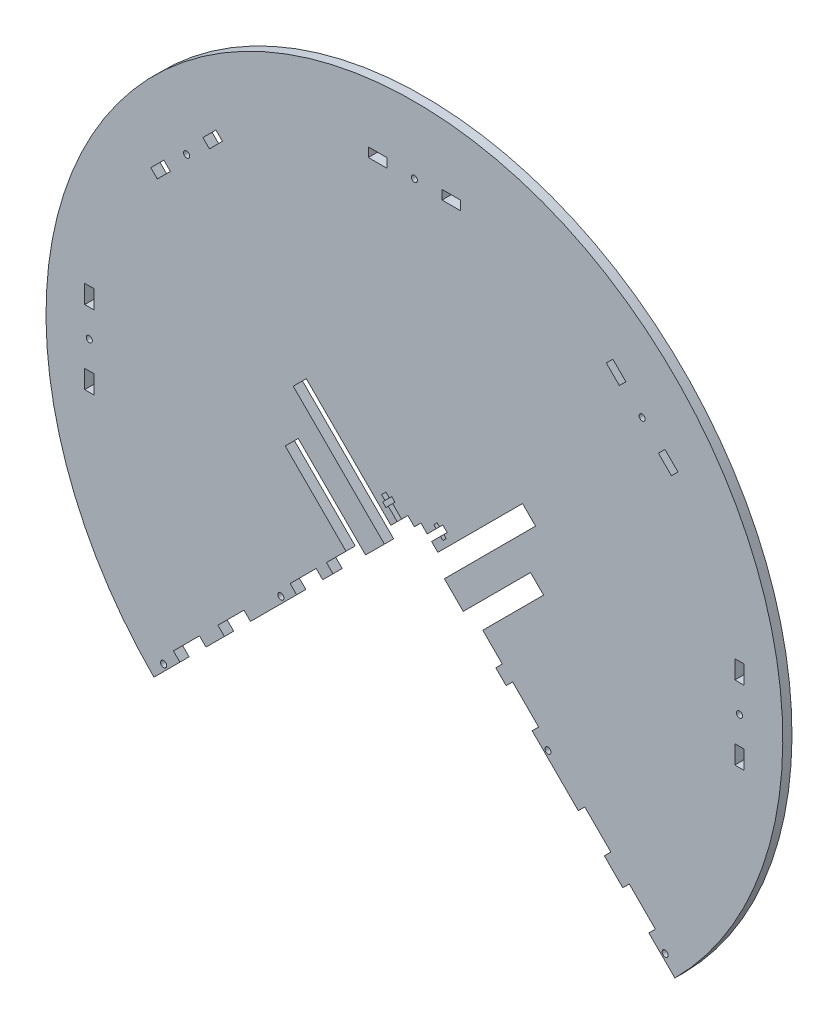
from build123d import *

# Parameters (mm, degrees)
SKETCH1_R           = 254
BOSS_EXTRUDE1_DEPTH = 6.35
CUT_EXTRUDE1_DEPTH  = 530.881249762
CUT_EXTRUDE2_DEPTH  = 466.964215177
SKETCH5_W           = 12.7
SKETCH5_H           = 6.35
SKETCH5_W_2         = 6.35
SKETCH5_H_2         = 12.7
CUT_EXTRUDE3_DEPTH  = 466.964215177
SKETCH6_R           = 2.0955
CUT_EXTRUDE4_DEPTH  = 466.964215177
SKETCH7_R           = 2.0955
CUT_EXTRUDE5_DEPTH  = 466.964215177
CUT_EXTRUDE6_DEPTH  = 466.964215177
CUT_EXTRUDE7_DEPTH  = 466.964215177
CUT_EXTRUDE8_DEPTH  = 466.964215177


with BuildPart() as part:
    # Sketch1 → Boss-Extrude1 (new body)
    with BuildSketch(Plane.XY):
        with Locations((0, -210.99227558)):
            Circle(SKETCH1_R)
    extrude(amount=BOSS_EXTRUDE1_DEPTH)

    # Sketch3 → Cut-Extrude1 (cut, through all)
    with BuildSketch(Plane(origin=(0, 0, 0), x_dir=(-1, 0, 0), z_dir=(0, 0, -1))):
        with BuildLine():
            Line((179.605122421, -390.597398001), (0, -210.99227558))
            Line((0, -210.99227558), (-179.605122421, -390.597398001))
            ThreePointArc((-179.605122421, -390.597398001), (0, -464.99227558), (179.605122421, -390.597398001))
        make_face()
    extrude(amount=-CUT_EXTRUDE1_DEPTH, mode=Mode.SUBTRACT)

    # Sketch4 → Cut-Extrude2 (cut, through all)
    with BuildSketch(Plane.XY.offset(6.35)):
        Polygon((-161.644610179, -372.636885759), (-166.13473824, -368.146757699), (-148.174225998, -350.186245456), (-143.684097937, -354.676373517), align=None)
        Polygon((-130.96805527, -341.960330849), (-135.45818333, -337.470202789), (-117.497671088, -319.509690547), (-113.007543028, -323.999818607), align=None)
        Polygon((-81.190495591, -292.18277117), (-85.680623651, -287.69264311), (-67.720111409, -269.732130868), (-63.229983348, -274.222258928), align=None)
        Polygon((-56.126600757, -267.118876336), (-60.616728817, -262.628748276), (-38.166088515, -240.178107973), (-33.675960454, -244.668236034), align=None)
        Polygon((-11.689323621, -222.681599201), (-16.179451682, -218.19147114), (-4.490128061, -206.502147519), (0, -210.99227558), align=None)
    cut_extrude2 = extrude(amount=-CUT_EXTRUDE2_DEPTH, mode=Mode.SUBTRACT)

    # Mirror1: Cut-Extrude2 across plane
    add(cut_extrude2.mirror(Plane(origin=(0, 0, 0), x_dir=(0, 0, 1), z_dir=(1, 0, 0))), mode=Mode.SUBTRACT)

    # Sketch5 → Cut-Extrude3 (cut, through all)
    with BuildSketch(Plane.XY.offset(6.35)):
        Polygon((177.244959777, -91.888783362), (181.735087838, -87.398655301), (172.754831717, -78.41839918), (168.264703656, -82.908527241), align=None)
        with Locations((-25.4, -3.175)):
            Rectangle(SKETCH5_W, SKETCH5_H)
        with Locations((25.4, -3.175)):
            Rectangle(SKETCH5_W, SKETCH5_H)
        with Locations((-224.155, -236.39227558)):
            Rectangle(SKETCH5_W_2, SKETCH5_H_2)
        with Locations((-224.155, -185.59227558)):
            Rectangle(SKETCH5_W_2, SKETCH5_H_2)
        with Locations((224.155, -185.59227558)):
            Rectangle(SKETCH5_W_2, SKETCH5_H_2)
        with Locations((224.155, -236.39227558)):
            Rectangle(SKETCH5_W_2, SKETCH5_H_2)
        Polygon((141.323935293, -55.967758877), (145.814063353, -51.477630817), (136.833807232, -42.497374696), (132.343679172, -46.987502756), align=None)
        Polygon((-177.244959777, -91.888783362), (-181.735087838, -87.398655301), (-172.754831717, -78.41839918), (-168.264703656, -82.908527241), align=None)
        Polygon((-141.323935293, -55.967758877), (-145.814063353, -51.477630817), (-136.833807232, -42.497374696), (-132.343679172, -46.987502756), align=None)
    extrude(amount=-CUT_EXTRUDE3_DEPTH, mode=Mode.SUBTRACT)

    # Sketch6 → Cut-Extrude4 (cut, through all)
    with BuildSketch(Plane.XY.offset(6.35)):
        with Locations((-172.869930331, -379.37207785)):
            Circle(SKETCH6_R)
        with Locations((-92.047625241, -298.54977276)):
            Circle(SKETCH6_R)
    cut_extrude4 = extrude(amount=-CUT_EXTRUDE4_DEPTH, mode=Mode.SUBTRACT)

    # Mirror2: Cut-Extrude4 across plane
    add(cut_extrude4.mirror(Plane(origin=(0, 0, 0), x_dir=(0, 0, 1), z_dir=(1, 0, 0))), mode=Mode.SUBTRACT)

    # Sketch7 → Cut-Extrude5 (cut, through all)
    with BuildSketch(Plane.XY.offset(6.35)):
        with Locations((-224.155, -210.99227558)):
            Circle(SKETCH7_R)
        with Locations((-157.039383505, -67.193079029)):
            Circle(SKETCH7_R)
        with Locations((0, -3.175)):
            Circle(SKETCH7_R)
        with Locations((157.039383505, -67.193079029)):
            Circle(SKETCH7_R)
        with Locations((224.155, -210.99227558)):
            Circle(SKETCH7_R)
    extrude(amount=-CUT_EXTRUDE5_DEPTH, mode=Mode.SUBTRACT)

    # Sketch8 → Cut-Extrude6 (cut, through all)
    with BuildSketch(Plane.XY.offset(6.35)):
        Polygon((-20.669579742, -231.661855322), (-11.689323621, -222.681599201), (-74.551116468, -159.819806353), (-83.53137259, -168.800062475), align=None)
    cut_extrude6 = extrude(amount=-CUT_EXTRUDE6_DEPTH, mode=Mode.SUBTRACT)

    # Mirror3: Cut-Extrude6 across plane
    add(cut_extrude6.mirror(Plane(origin=(0, 0, 0), x_dir=(0, 0, 1), z_dir=(1, 0, 0))), mode=Mode.SUBTRACT)

    # Sketch9 → Cut-Extrude7 (cut, through all)
    with BuildSketch(Plane.XY.offset(6.35)):
        Polygon((-11.843472899, -213.855492358), (-8.826106843, -210.838126301), (-15.022483566, -204.641749578), (-13.388076952, -203.007342964), (-15.633140982, -200.762278934), (-17.267547597, -202.396685548), (-19.602414188, -200.061818956), (-22.619780245, -203.079185013), (-20.284913653, -205.414051604), (-21.919320267, -207.048458218), (-19.674256237, -209.293522249), (-18.039849623, -207.659115635), align=None)
    cut_extrude7 = extrude(amount=-CUT_EXTRUDE7_DEPTH, mode=Mode.SUBTRACT)

    # Mirror4: Cut-Extrude7 across plane
    add(cut_extrude7.mirror(Plane(origin=(0, 0, 0), x_dir=(0, 0, 1), z_dir=(1, 0, 0))), mode=Mode.SUBTRACT)

    # Sketch10 → Cut-Extrude8 (cut, through all)
    with BuildSketch(Plane.XY.offset(6.35)):
        Polygon((-80.080712821, -198.263483667), (-89.060968942, -207.243739788), (-42.656216575, -253.648492155), (-33.675960454, -244.668236034), align=None)
    cut_extrude8 = extrude(amount=-CUT_EXTRUDE8_DEPTH, mode=Mode.SUBTRACT)

    # Mirror5: Cut-Extrude8 across plane
    add(cut_extrude8.mirror(Plane(origin=(0, 0, 0), x_dir=(0, 0, 1), z_dir=(1, 0, 0))), mode=Mode.SUBTRACT)


solid = part.part
